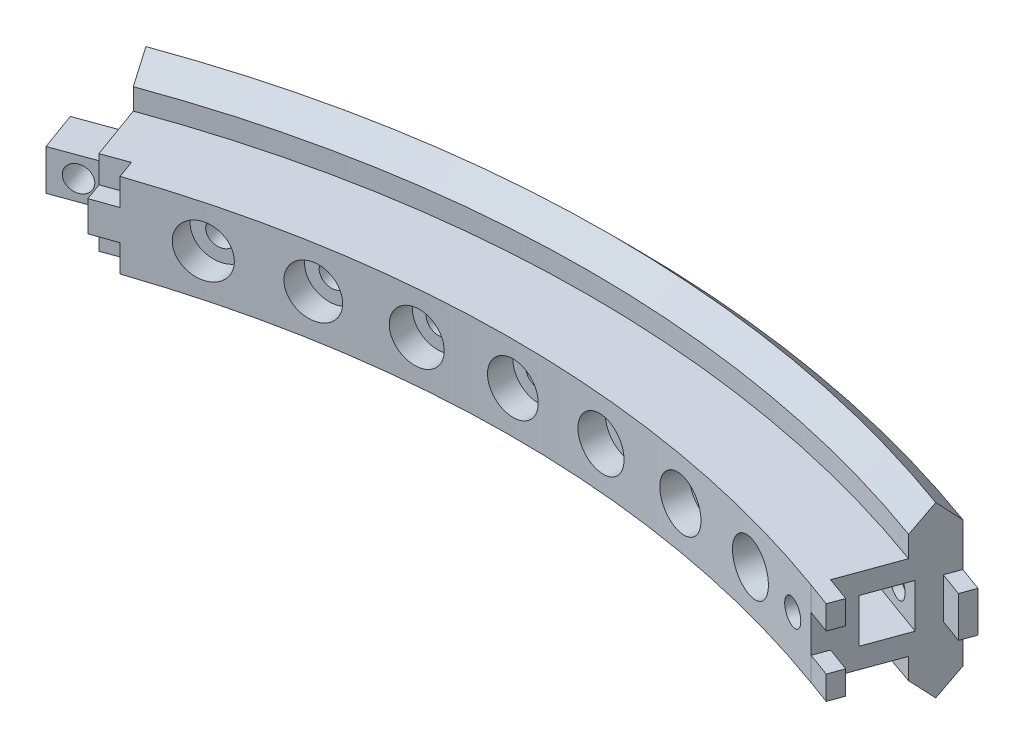
from build123d import *

# Parameters (mm, degrees)
REVOLVE_1_ANGLE          = 40
SKETCH_3_W               = 5.2
SKETCH_3_H               = 5.2
CUT_EXTRUDE_1_DEPTH      = 7
SKETCH_4_W               = 4.8
SKETCH_4_H               = 4.8
EXTRUDE_1_DEPTH          = 6
CUT_EXTRUDE_2_DEPTH      = 98.941918912
CUT_EXTRUDE_2_DEPTH_BACK = 98.941918912
SKETCH_5_R               = 1.5
CUT_EXTRUDE_START        = -1
SKETCH_6_R               = 3
CUT_EXTRUDE_3_DEPTH      = 98.947267083
SKETCH_7_R               = 1.5
CUT_EXTRUDE_4_DEPTH      = 95.895882318
SKETCH_11_R              = 1.5
CUT_EXTRUDE_6_DEPTH      = 57.807113078
CUT_EXTRUDE_7_DEPTH      = 5
SKETCH_13_W              = 3
SKETCH_13_H              = 3
PATTERN_CIRCULAR_1_COUNT = 4
PATTERN_CIRCULAR_1_ANGLE = 15
F_1_THE_OTHER_WAY_COUNT  = 4
F_1_THE_OTHER_WAY_ANGLE  = 15
SKETCH_9_W               = 1.8
SKETCH_9_H               = 4.8
SKETCH_9_H_2             = 2.8
EXTRUDE_2_DEPTH          = 3
SKETCH_10_W              = 2.2
SKETCH_10_H              = 5.2
CUT_EXTRUDE_5_DEPTH      = 3


# Read off the part's stored shape, not the designer's step: 旋转1
with BuildPart() as part:
    # 旋转1 outline → 旋转1 (revolve)
    with BuildSketch(Plane(origin=(0, 0, 0), x_dir=(0.3420201433256701, 0, -0.9396926207859079), z_dir=(0.9396926207859079, 0, 0.3420201433256701))):
        Polygon((134, 5), (125, 5), (125, -5), (134, -5), (134, -7.5), (136.5, -10), (139, -7.5), (139, 7.5), (136.5, 10), (134, 7.5), align=None)
    revolve(axis=Axis((0, 0, 0), (0, 1, 0)), revolution_arc=REVOLVE_1_ANGLE)

    # 草图3 → 切除-拉伸1 (cut)
    with BuildSketch(Plane(origin=(0, 0, 0), x_dir=(0.34202014332566943, 0, -0.9396926207859081), z_dir=(0.9396926207859081, 0, 0.34202014332566943))):
        with Locations((132, 0)):
            Rectangle(SKETCH_3_W, SKETCH_3_H)
    extrude(amount=-CUT_EXTRUDE_1_DEPTH, mode=Mode.SUBTRACT)

    # 草图4 → 凸台-拉伸1 (add)
    with BuildSketch(Plane(origin=(0, 0, 0), x_dir=(0.3420201433256631, 0, 0.9396926207859104), z_dir=(-0.9396926207859104, 0, 0.3420201433256631))):
        with Locations((-132, 0)):
            Rectangle(SKETCH_4_W, SKETCH_4_H)
    extrude(amount=EXTRUDE_1_DEPTH)

    # 草图5 → 切除-拉伸2 (cut, two sides: drawn at the far end of the back side and taken through both)
    with BuildSketch(Plane(origin=(44.257406546, 0, -121.59622513), x_dir=(-0.9396926207859081, 0, -0.3420201433256695), z_dir=(0.3420201433256695, 0, -0.9396926207859081)).offset(-CUT_EXTRUDE_2_DEPTH_BACK)):
        with Locations((3.5, 0)):
            Circle(SKETCH_5_R)
    extrude(amount=CUT_EXTRUDE_2_DEPTH + CUT_EXTRUDE_2_DEPTH_BACK, mode=Mode.SUBTRACT)

    # 草图6 → 切除-拉伸3 (cut, through all)
    with BuildSketch(Plane(origin=(46.035911292, 0, -126.482626758), x_dir=(0.9396926207859081, 0, 0.3420201433256695), z_dir=(-0.3420201433256695, 0, 0.9396926207859081)).offset(CUT_EXTRUDE_START)):
        with Locations((-3.5, 0)):
            Circle(SKETCH_6_R)
    extrude(amount=-CUT_EXTRUDE_3_DEPTH, mode=Mode.SUBTRACT)

    # 草图7 → 切除-拉伸4 (cut, through all)
    with BuildSketch(Plane(origin=(-45.967507263, 0, -126.294688234), x_dir=(-0.9396926207859105, 0, 0.3420201433256632), z_dir=(-0.3420201433256632, 0, -0.9396926207859105))):
        with Locations((3, 0)):
            Circle(SKETCH_7_R)
    extrude(amount=-CUT_EXTRUDE_4_DEPTH, mode=Mode.SUBTRACT)

    # 草图11 → 切除-拉伸6 (cut, through all)
    with BuildSketch(Plane(origin=(0, 0, -139), x_dir=(-1, 0, 0), z_dir=(0, 0, -1))):
        Circle(SKETCH_11_R)
    cut_extrude_6 = extrude(amount=-CUT_EXTRUDE_6_DEPTH, mode=Mode.SUBTRACT)

    # 草图12 → 切除-拉伸7 (cut)
    with BuildSketch(Plane(origin=(0, 0, -139), x_dir=(-1, 0, 0), z_dir=(0, 0, -1))):
        Polygon((0, -3.175426481), (2.75, -1.58771324), (2.75, 1.58771324), (0, 3.175426481), (-2.75, 1.58771324), (-2.75, -1.58771324), align=None)
    cut_extrude_7 = extrude(amount=-CUT_EXTRUDE_7_DEPTH, mode=Mode.SUBTRACT)

    # 草图13 → 切除-旋转1 (revolve, cut)
    with BuildSketch(Plane(origin=(0, 0, 0), x_dir=(1, 0, 0), z_dir=(0, 1, 0)), mode=Mode.PRIVATE) as cut_revolve_1_sk:
        with Locations((1.5, 126.463994814)):
            Rectangle(SKETCH_13_W, SKETCH_13_H)
    cut_revolve_1 = revolve(cut_revolve_1_sk.sketch.rotate(Axis((0, 0, 1001.142351785), (0, 0, -1)), 180), axis=Axis((0, 0, 1001.142351785), (0, 0, -1)), mode=Mode.SUBTRACT)

    # 阵列(圆周)1: 切除-拉伸6, 切除-拉伸7, 切除-旋转1 ×4 about axis
    pattern_circular_1_axis = Axis((0, 0, 0), (0, -1, 0))
    add([cut_extrude_6.rotate(pattern_circular_1_axis, i * PATTERN_CIRCULAR_1_ANGLE / (PATTERN_CIRCULAR_1_COUNT - 1)) for i in range(1, PATTERN_CIRCULAR_1_COUNT)], mode=Mode.SUBTRACT)
    add([cut_extrude_7.rotate(pattern_circular_1_axis, i * PATTERN_CIRCULAR_1_ANGLE / (PATTERN_CIRCULAR_1_COUNT - 1)) for i in range(1, PATTERN_CIRCULAR_1_COUNT)], mode=Mode.SUBTRACT)
    add([cut_revolve_1.rotate(pattern_circular_1_axis, i * PATTERN_CIRCULAR_1_ANGLE / (PATTERN_CIRCULAR_1_COUNT - 1)) for i in range(1, PATTERN_CIRCULAR_1_COUNT)], mode=Mode.SUBTRACT)

    # 1 the other way: 切除-拉伸6, 切除-拉伸7, 切除-旋转1 ×4 about axis
    f_1_the_other_way_axis = Axis((0, 0, 0), (0, 1, 0))
    add([cut_extrude_6.rotate(f_1_the_other_way_axis, i * F_1_THE_OTHER_WAY_ANGLE / (F_1_THE_OTHER_WAY_COUNT - 1)) for i in range(1, F_1_THE_OTHER_WAY_COUNT)], mode=Mode.SUBTRACT)
    add([cut_extrude_7.rotate(f_1_the_other_way_axis, i * F_1_THE_OTHER_WAY_ANGLE / (F_1_THE_OTHER_WAY_COUNT - 1)) for i in range(1, F_1_THE_OTHER_WAY_COUNT)], mode=Mode.SUBTRACT)
    add([cut_revolve_1.rotate(f_1_the_other_way_axis, i * F_1_THE_OTHER_WAY_ANGLE / (F_1_THE_OTHER_WAY_COUNT - 1)) for i in range(1, F_1_THE_OTHER_WAY_COUNT)], mode=Mode.SUBTRACT)

    # 草图9 → 凸台-拉伸2 (add)
    with BuildSketch(Plane(origin=(0, 0, 0), x_dir=(0.34202014332566943, 0, -0.9396926207859082), z_dir=(0.9396926207859082, 0, 0.34202014332566943))):
        with Locations((138.1, 0)):
            Rectangle(SKETCH_9_W, SKETCH_9_H)
        with Locations((125.9, 3.6)):
            Rectangle(SKETCH_9_W, SKETCH_9_H_2)
        with Locations((125.9, -3.6)):
            Rectangle(SKETCH_9_W, SKETCH_9_H_2)
    extrude(amount=EXTRUDE_2_DEPTH)

    # 草图10 → 切除-拉伸5 (cut)
    with BuildSketch(Plane(origin=(0, 0, 0), x_dir=(0.3420201433256631, 0, 0.9396926207859104), z_dir=(-0.9396926207859104, 0, 0.3420201433256631))):
        with Locations((-137.9, 0)):
            Rectangle(SKETCH_10_W, SKETCH_10_H)
        Polygon((-127.2, 5), (-125, 5), (-123.655375964, 5), (-123.655375964, 1.8), (-125, 1.8), (-127.2, 1.8), align=None)
        Polygon((-127.2, -1.8), (-125, -1.8), (-123.655375964, -1.8), (-123.655375964, -5), (-125, -5), (-127.2, -5), align=None)
    extrude(amount=-CUT_EXTRUDE_5_DEPTH, mode=Mode.SUBTRACT)


solid = part.part
